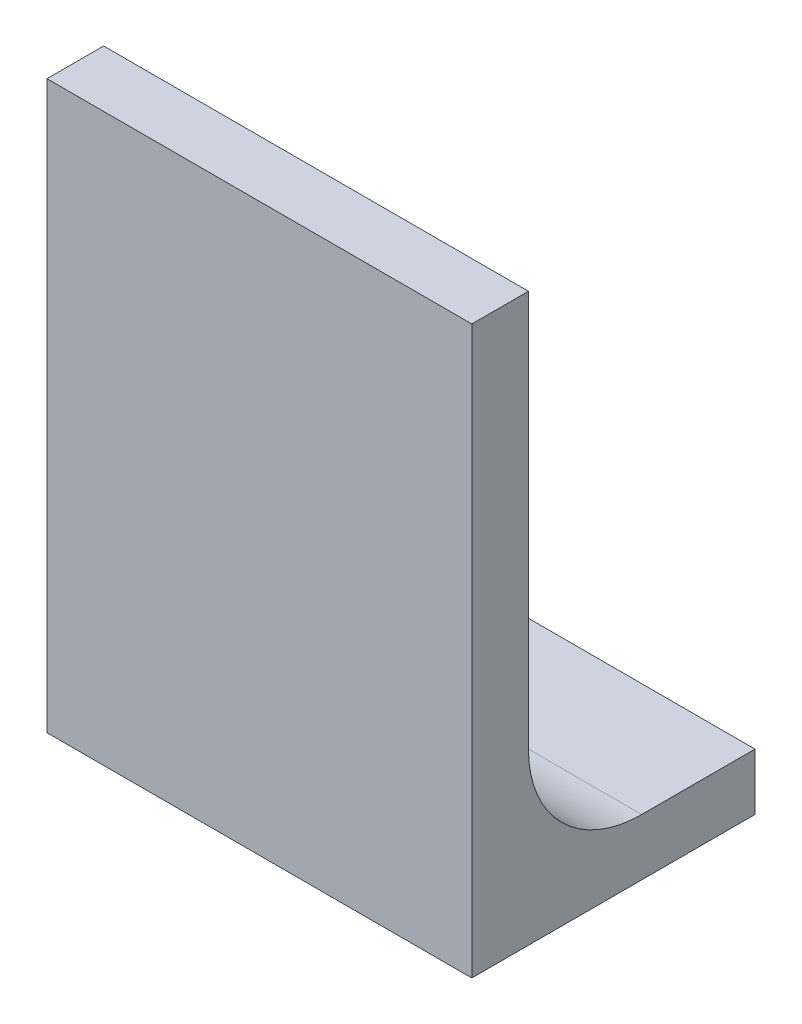
from build123d import *

# Parameters (mm, degrees)
SKETCH1_W           = 7.5
SKETCH1_H           = 10
BOSS_EXTRUDE2_DEPTH = 1
SKETCH1_3_W         = 7.5
SKETCH1_3_H         = 1
BOSS_EXTRUDE3_DEPTH = 5
FILLET1_R           = 2


with BuildPart() as part:
    # Sketch1 → Boss-Extrude2 (new body)
    with BuildSketch(Plane(origin=(0, 0, -1.75), x_dir=(-1, 0, 0), z_dir=(0, 0, -1))):
        with Locations((-32.757235606, 4.083823073)):
            Rectangle(SKETCH1_W, SKETCH1_H)
    extrude(amount=BOSS_EXTRUDE2_DEPTH)

    # Sketch1<3> → Boss-Extrude3 (add)
    with BuildSketch(Plane(origin=(0, 0, -1.75), x_dir=(-1, 0, 0), z_dir=(0, 0, -1))):
        with Locations((-32.757235606, -0.416176927)):
            Rectangle(SKETCH1_3_W, SKETCH1_3_H)
    extrude(amount=BOSS_EXTRUDE3_DEPTH)

    # Fillet1
    fillet1_edges = [part.edges().sort_by_distance(p)[0] for p in [
        (32.757235606, 0.083823073, -2.75),
    ]]
    fillet(fillet1_edges, radius=FILLET1_R)


solid = part.part
